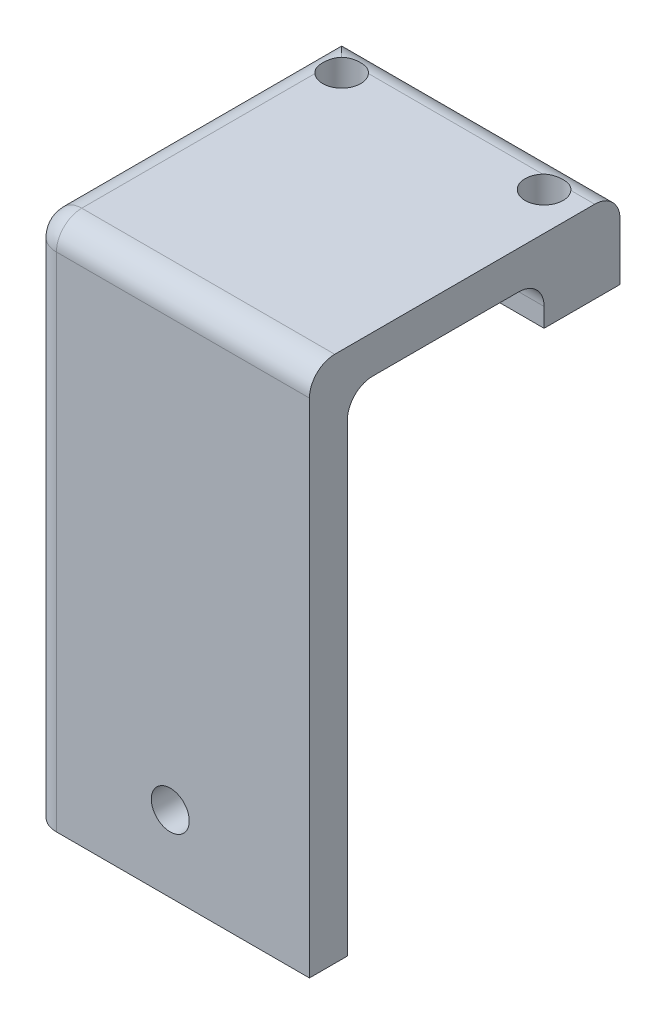
from build123d import *

# Parameters (mm, degrees)
SKETCH1_W           = 3
SKETCH1_H           = 38.7
SKETCH1_H_2         = 3
SKETCH1_W_2         = 6
SKETCH1_H_3         = 3.5
BOSS_EXTRUDE1_DEPTH = 11
SKETCH2_R           = 1.5
CUT_EXTRUDE1_DEPTH  = 10
SKETCH3_R           = 1.5
CUT_EXTRUDE2_DEPTH  = 10
FILLET1_R           = 2


with BuildPart() as part:
    # Sketch1 → Boss-Extrude1 (new, symmetric)
    with BuildSketch(Plane(origin=(0, 0, 0), x_dir=(0, 0, -1), z_dir=(1, 0, 0))):
        with Locations((0, -1.5)):
            Rectangle(SKETCH1_W, SKETCH1_H)
        with Locations((0, 19.35)):
            Rectangle(SKETCH1_W, SKETCH1_H_2)
        Polygon((23.05, 20.85), (1.5, 20.85), (1.5, 17.85), (17.035825545, 17.85), (17.05, 17.85), (23.05, 17.85), align=None)
        with Locations((20.05, 16.1)):
            Rectangle(SKETCH1_W_2, SKETCH1_H_3)
    extrude(amount=BOSS_EXTRUDE1_DEPTH, both=True)

    # Sketch2 → Cut-Extrude1 (cut)
    with BuildSketch(Plane.XY.offset(1.5)):
        with Locations((0, -14.85)):
            Circle(SKETCH2_R)
    extrude(amount=-CUT_EXTRUDE1_DEPTH, mode=Mode.SUBTRACT)

    # Sketch3 → Cut-Extrude2 (cut)
    with BuildSketch(Plane(origin=(0, 20.85, 0), x_dir=(1, 0, 0), z_dir=(0, 1, 0))):
        with Locations(Location((-8, 20.05, 0), (0, 0, 270))):
            Circle(SKETCH3_R)
        with Locations(Location((8, 20.05, 0), (0, 0, 90))):
            Circle(SKETCH3_R)
    extrude(amount=-CUT_EXTRUDE2_DEPTH, mode=Mode.SUBTRACT)

    # Fillet1
    # the kernel refuses this fillet: 2 mm, written as the material it adds along each edge
    with BuildSketch(Plane(origin=(-11, 17.85, -17.05), x_dir=(0, 0, 1), z_dir=(1, 0, 0)), Plane(origin=(-11, 17.85, -1.5), x_dir=(0, -1, 0), z_dir=(1, 0, 0))) as fillet1_piece_1:
        with BuildLine():
            CenterArc((FILLET1_R, FILLET1_R), FILLET1_R, 180, 90)
            Line((0, FILLET1_R), (0, 0))
            Line((0, 0), (FILLET1_R, 0))
        make_face()
    extrude(amount=22)
    # the kernel refuses this fillet: 2 mm, written as the material it takes off along each edge
    with BuildSketch(Plane(origin=(-9, 18.85, -0.5), x_dir=(-1, 0, 0), z_dir=(0, 0, 1))) as fillet1_2_piece_1_section:
        Polygon((0, 0), (FILLET1_R, 0), (FILLET1_R, -FILLET1_R), (0, -FILLET1_R), align=None)
    fillet1_2_piece_1 = extrude(amount=FILLET1_R, mode=Mode.PRIVATE)
    fillet1_2_piece_1 = fillet1_2_piece_1 - Plane(origin=(-9, 18.85, -0.5), x_dir=(0.7071067811865475, -0.7071067811865475, 0), z_dir=(0, 0, 1)) * Sphere(FILLET1_R, mode=Mode.PRIVATE)
    add(fillet1_2_piece_1, mode=Mode.SUBTRACT)
    with BuildSketch(Plane(origin=(-11, 18.85, 1.5), x_dir=(1, 0, 0), z_dir=(0, -1, 0))) as fillet1_2_piece_2:
        with BuildLine():
            CenterArc((FILLET1_R, -FILLET1_R), FILLET1_R, 90, 90)
            Line((0, -FILLET1_R), (0, 0))
            Line((0, 0), (FILLET1_R, 0))
        make_face()
    extrude(amount=44.7, mode=Mode.SUBTRACT)
    with BuildSketch(Plane(origin=(-11, 20.85, -28.05), x_dir=(0, -1, 0), z_dir=(0, 0, 1))) as fillet1_2_piece_3:
        with BuildLine():
            CenterArc((FILLET1_R, FILLET1_R), FILLET1_R, 180, 90)
            Line((0, FILLET1_R), (0, 0))
            Line((0, 0), (FILLET1_R, 0))
        make_face()
    extrude(amount=27.55, mode=Mode.SUBTRACT)
    with BuildSketch(Plane(origin=(16, 20.85, 1.5), x_dir=(0, -1, 0), z_dir=(-1, 0, 0))) as fillet1_2_piece_4:
        with BuildLine():
            CenterArc((FILLET1_R, -FILLET1_R), FILLET1_R, 90, 90)
            Line((0, -FILLET1_R), (0, 0))
            Line((0, 0), (FILLET1_R, 0))
        make_face()
    extrude(amount=25, mode=Mode.SUBTRACT)
    with BuildSketch(Plane(origin=(16, 20.85, -23.05), x_dir=(0, 0, 1), z_dir=(-1, 0, 0))) as fillet1_2_piece_5:
        with BuildLine():
            CenterArc((FILLET1_R, -FILLET1_R), FILLET1_R, 90, 90)
            Line((0, -FILLET1_R), (0, 0))
            Line((0, 0), (FILLET1_R, 0))
        make_face()
    extrude(amount=32, mode=Mode.SUBTRACT)


solid = part.part
